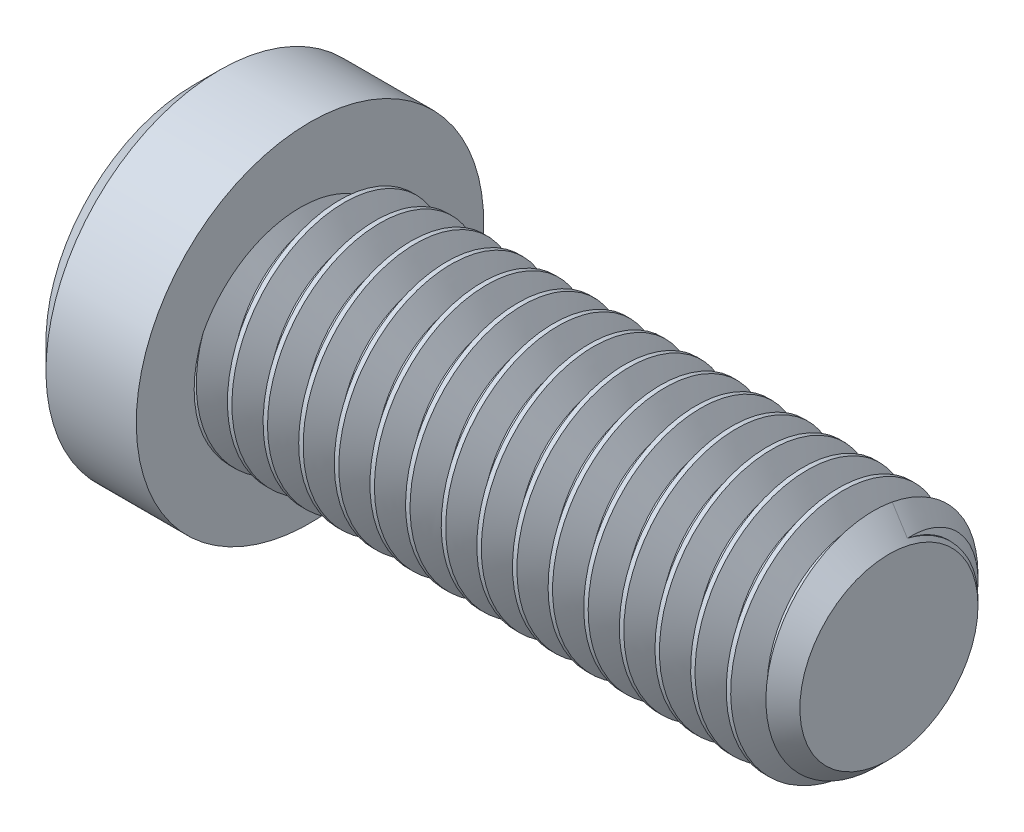
from build123d import *

# Parameters (mm, degrees)
SKETCH2_R           = 6.35
BOSS_EXTRUDE1_DEPTH = 31.75
CHAMFER1_SIZE       = 1.465384615
CUT_SWEEP1_PITCH    = 1.953846154
CUT_EXTRUDE1_DEPTH  = 3.8354


with BuildPart() as part:
    # Sketch2 → Boss-Extrude1 (new body)
    with BuildSketch(Plane(origin=(15.875, 0, 0), x_dir=(0, 0, -1), z_dir=(1, 0, 0))):
        Circle(SKETCH2_R)
    extrude(amount=-BOSS_EXTRUDE1_DEPTH)

    # Chamfer1
    chamfer1_edges = [part.edges().sort_by_distance(p)[0] for p in [
        (15.875, 0, 6.35),
    ]]
    chamfer(chamfer1_edges, length=CHAMFER1_SIZE)

    # Cut-Sweep1: the profile of Sketch5 profile screwed along a right-hand helix of 17.25 turns, 10 arcs to a turn; built about Z, then put on its axis
    cut_sweep1_z = Axis((0, 0, 0), (0, 0, 1))
    cut_sweep1_corners = [(6.3503, 0, 0.854980897), (6.3503, 0, -0.854980897), (5.080939697, 0, -0.122115385), (5.080939697, 0, 0.122115385)]
    with BuildLine(mode=Mode.PRIVATE) as cut_sweep1_profile:
        Line(cut_sweep1_corners[0], cut_sweep1_corners[1])
        Line(cut_sweep1_corners[1], cut_sweep1_corners[2])
        Line(cut_sweep1_corners[2], cut_sweep1_corners[3])
        Line(cut_sweep1_corners[3], cut_sweep1_corners[0])
    cut_sweep1_cap = Face(cut_sweep1_profile.wire())
    cut_sweep1_turn_angles = [0, 18, 36, 54, 72, 90, 108, 126, 144, 162, 180, 198, 216, 234, 252, 270, 288, 306, 324, 342, 360]
    cut_sweep1_turn_weights = [1, 0.9510565162951535, 1, 0.9510565162951535, 1, 0.9510565162951535, 1, 0.9510565162951535, 1, 0.9510565162951535, 1, 0.9510565162951535, 1, 0.9510565162951535, 1, 0.9510565162951535, 1, 0.9510565162951535, 1, 0.9510565162951535, 1]
    cut_sweep1_turn_rails = [Edge.make_bspline([Vector(p[0], p[1], 0).rotate(cut_sweep1_z, cut_sweep1_turn_angles[k]) / cut_sweep1_turn_weights[k] + Vector(0, 0, p[2] + CUT_SWEEP1_PITCH * cut_sweep1_turn_angles[k] / 360) for k in range(21)], [0, 0, 0, 1, 1, 2, 2, 3, 3, 4, 4, 5, 5, 6, 6, 7, 7, 8, 8, 9, 9, 10, 10, 10], 2, cut_sweep1_turn_weights) for p in cut_sweep1_corners]
    cut_sweep1_turn_sides = [Face.make_surface_from_curves(cut_sweep1_turn_rails[p[0]], cut_sweep1_turn_rails[p[1]]) for p in [(0, 1), (1, 2), (2, 3), (3, 0)]]
    cut_sweep1_last_angles = [6120, 6138, 6156, 6174, 6192, 6201, 6210]
    cut_sweep1_last_weights = [1, 0.9510565162951535, 1, 0.9510565162951535, 1, 0.9876883405951787, 1]
    cut_sweep1_last_rails = [Edge.make_bspline([Vector(p[0], p[1], 0).rotate(cut_sweep1_z, cut_sweep1_last_angles[k]) / cut_sweep1_last_weights[k] + Vector(0, 0, p[2] + CUT_SWEEP1_PITCH * cut_sweep1_last_angles[k] / 360) for k in range(7)], [0, 0, 0, 1, 1, 2, 2, 3, 3, 3], 2, cut_sweep1_last_weights) for p in cut_sweep1_corners]
    cut_sweep1_last_sides = [Face.make_surface_from_curves(cut_sweep1_last_rails[p[0]], cut_sweep1_last_rails[p[1]]) for p in [(0, 1), (1, 2), (2, 3), (3, 0)]]
    cut_sweep1 = Plane(origin=(15.875, 0, 0), x_dir=(0, 1, 0), z_dir=(-1, 0, 0)) * Solid(Shell([*[p.moved(Location((0, 0, CUT_SWEEP1_PITCH * i))) for i in range(17) for p in cut_sweep1_turn_sides], *cut_sweep1_last_sides, cut_sweep1_cap, cut_sweep1_cap.rotate(cut_sweep1_z, 6210).moved(Location((0, 0, CUT_SWEEP1_PITCH * 6210 / 360)))]))
    add(cut_sweep1, mode=Mode.SUBTRACT)

    # Sketch6 → Revolve1 (revolve)
    with BuildSketch(Plane.XY, mode=Mode.PRIVATE) as revolve1_sk:
        Polygon((-20.828, 9.525), (-22.225, 8.128), (-22.225, 0), (-15.875, 0), (-15.875, 9.525), align=None)
    revolve(revolve1_sk.sketch.rotate(Axis((-15.875, 0, 0), (-1, 0, 0)), 13.740040815), axis=Axis((-15.875, 0, 0), (-1, 0, 0)))

    # Sketch4 → Cut-Extrude1 (cut)
    with BuildSketch(Plane(origin=(-22.225, 0, 0), x_dir=(0, 0, -1), z_dir=(1, 0, 0))):
        Polygon((0, 3.666174209), (-3.175, 1.833087105), (-3.175, -1.833087105), (0, -3.666174209), (3.175, -1.833087105), (3.175, 1.833087105), align=None)
    extrude(amount=CUT_EXTRUDE1_DEPTH, mode=Mode.SUBTRACT)

    # Cut-Extrude2 cone 1 section (through the dimple's axis) → Cut-Extrude2 (revolve, cut)
    with BuildSketch(Plane(origin=(-22.225, 0, 0), x_dir=(0, 0, 1), z_dir=(0, 1, 0))):
        Polygon((0, 0), (3.666174209, 0), (0, 3.666174209), align=None)
    revolve(axis=Axis((-22.225, 0, 0), (1, 0, 0)), mode=Mode.SUBTRACT)


solid = part.part
